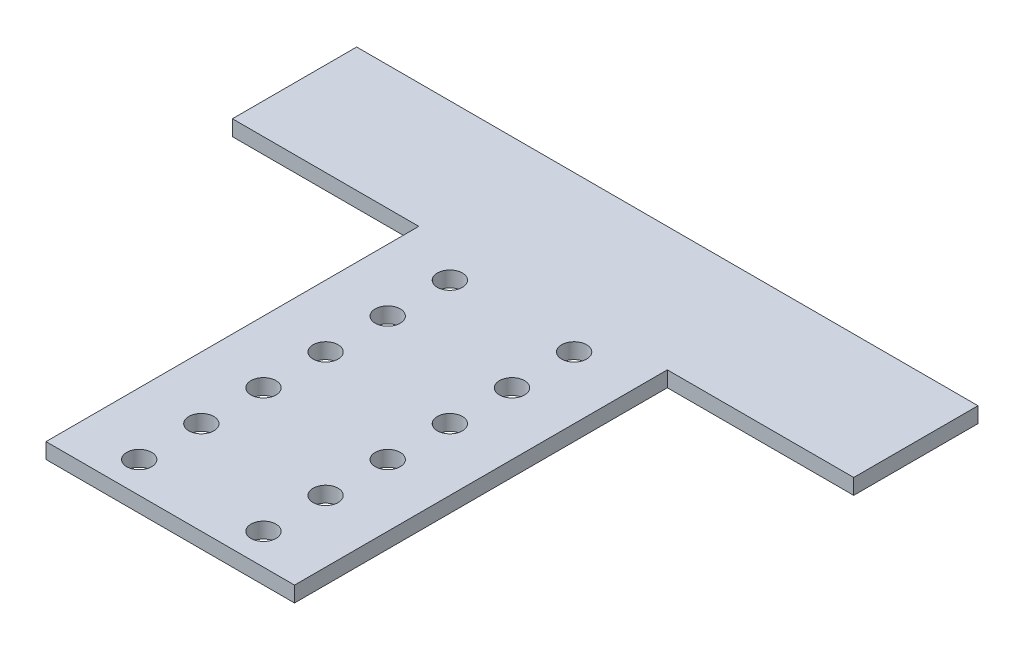
from build123d import *

# Parameters (mm, degrees)
BOSS_EXTRUDE1_DEPTH = 3.175
SKETCH2_R           = 2.5527
CUT_EXTRUDE1_DEPTH  = 136.04018152


with BuildPart() as part:
    # Sketch1 → Boss-Extrude1 (new body)
    with BuildSketch(Plane(origin=(0, 0, 0), x_dir=(1, 0, 0), z_dir=(0, 1, 0))):
        Polygon((0, 0), (50.8, 0), (50.8, 76.2), (88.9, 76.2), (88.9, 101.6), (-38.1, 101.6), (-38.1, 76.2), (0, 76.2), align=None)
    extrude(amount=BOSS_EXTRUDE1_DEPTH)

    # Sketch2 → Cut-Extrude1 (cut, through all)
    with BuildSketch(Plane(origin=(0, 3.175, 0), x_dir=(1, 0, 0), z_dir=(0, 1, 0))):
        with Locations((38.1, 6.35)):
            Circle(SKETCH2_R)
        with Locations((12.7, 6.35)):
            Circle(SKETCH2_R)
        with Locations((38.1, 19.05)):
            Circle(SKETCH2_R)
        with Locations((12.7, 19.05)):
            Circle(SKETCH2_R)
        with Locations((38.1, 31.75)):
            Circle(SKETCH2_R)
        with Locations((12.7, 31.75)):
            Circle(SKETCH2_R)
        with Locations((38.1, 44.45)):
            Circle(SKETCH2_R)
        with Locations((12.7, 44.45)):
            Circle(SKETCH2_R)
        with Locations((38.1, 57.15)):
            Circle(SKETCH2_R)
        with Locations((12.7, 57.15)):
            Circle(SKETCH2_R)
        with Locations((38.1, 69.85)):
            Circle(SKETCH2_R)
        with Locations((12.7, 69.85)):
            Circle(SKETCH2_R)
    extrude(amount=-CUT_EXTRUDE1_DEPTH, mode=Mode.SUBTRACT)


solid = part.part
